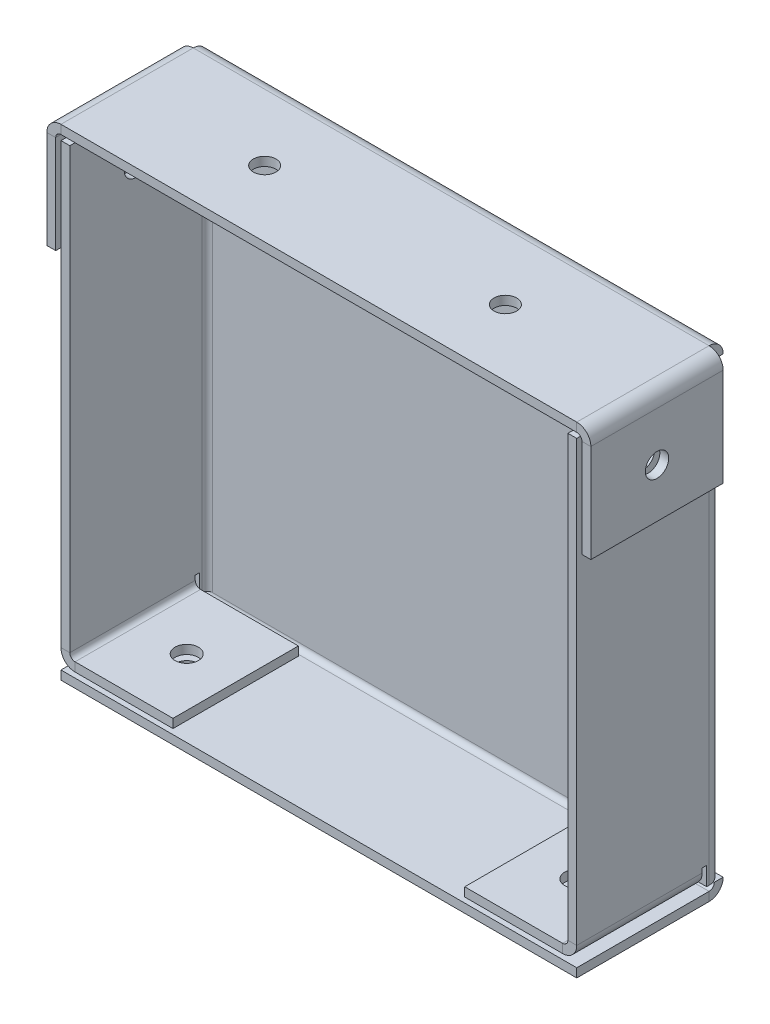
from build123d import *

# Parameters (mm, degrees)
SKETCH1_W                        = 75
SKETCH1_H                        = 70
BASE_FLANGE1_DEPTH               = 1.29
EDGE_FLANGE1_STRIP_W             = 6.684
EDGE_FLANGE1_STRIP_H             = 1.29
EDGE_FLANGE1_STRIP_CUT_DEPTH     = 75
EDGE_FLANGE1_DEPTH               = 75
EDGE_FLANGE2_STRIP_W             = 6.684
EDGE_FLANGE2_STRIP_H             = 1.29
EDGE_FLANGE2_STRIP_CUT_DEPTH     = 75
EDGE_FLANGE2_DEPTH               = 75
EDGE_FLANGE3_STRIP_W             = 6.684
EDGE_FLANGE3_STRIP_H             = 1.29
EDGE_FLANGE3_STRIP_CUT_DEPTH     = 65.896
EDGE_FLANGE3_DEPTH               = 65.896
EDGE_FLANGE4_STRIP_W             = 6.684
EDGE_FLANGE4_STRIP_H             = 1.29
EDGE_FLANGE4_STRIP_CUT_DEPTH     = 65.896
EDGE_FLANGE4_DEPTH               = 65.896
EDGE_FLANGE6_START               = 1.117
EDGE_FLANGE6_DEPTH               = 18.883
EDGE_FLANGE6_2_DEPTH             = 0.645
EDGE_FLANGE6_START_2             = 1.762
EDGE_FLANGE6_3_DEPTH             = 18.238
EDGE_FLANGE8_START               = 1.117
EDGE_FLANGE8_DEPTH               = 18.883
EDGE_FLANGE8_2_DEPTH             = 0.645
EDGE_FLANGE8_START_2             = 1.762
EDGE_FLANGE8_3_DEPTH             = 18.238
EDGE_FLANGE9_DEPTH               = 19.238
EDGE_FLANGE10_DEPTH              = 19.238
TAP_DRILL_FOR_M4X0_7_TAP1_REACH  = 108.005
TAP_DRILL_FOR_M4X0_7_TAP1_BORE_R = 1.65
M3_CLEARANCE_HOLE1_D             = 3.4
M3_CLEARANCE_HOLE1_DEPTH         = 3.342
M3_CLEARANCE_HOLE2_D             = 3.4


# Read off the part's stored shape, not the designer's step: Edge-Flange6, Edge-Flange8
# Sheet-metal steps are written as plain solids
with BuildPart() as part:
    # Sketch1 → Base-Flange1 (new body)
    with BuildSketch(Plane.XY):
        with Locations((37.5, 35)):
            Rectangle(SKETCH1_W, SKETCH1_H)
    extrude(amount=-BASE_FLANGE1_DEPTH)

    # Edge-Flange1 strip (across the edge) → Edge-Flange1 strip cut (cut)
    with BuildSketch(Plane(origin=(75, 70, 0), x_dir=(0, -1, 0), z_dir=(-1, 0, 0))):
        with Locations((-1.29, -0.645)):
            Rectangle(EDGE_FLANGE1_STRIP_W, EDGE_FLANGE1_STRIP_H)
    extrude(amount=EDGE_FLANGE1_STRIP_CUT_DEPTH, mode=Mode.SUBTRACT)

    # Edge-Flange1 section (across the edge) → Edge-Flange1 (add)
    with BuildSketch(Plane(origin=(75, 70, 0), x_dir=(0, -1, 0), z_dir=(-1, 0, 0))):
        with BuildLine():
            Line((0, 0.762), (0, 20))
            Line((0, 20), (1.29, 20))
            Line((1.29, 20), (1.29, 0.762))
            ThreePointArc((1.29, 0.762), (1.513184633, 0.223184633), (2.052, 0))
            Line((2.052, 0), (2.052, -1.29))
            ThreePointArc((2.052, -1.29), (0.601016885, -0.688983115), (0, 0.762))
        make_face()
    extrude(amount=EDGE_FLANGE1_DEPTH)

    # Edge-Flange2 strip (across the edge) → Edge-Flange2 strip cut (cut)
    with BuildSketch(Plane.YZ):
        with Locations((-1.29, -0.645)):
            Rectangle(EDGE_FLANGE2_STRIP_W, EDGE_FLANGE2_STRIP_H)
    extrude(amount=EDGE_FLANGE2_STRIP_CUT_DEPTH, mode=Mode.SUBTRACT)

    # Edge-Flange2 section (across the edge) → Edge-Flange2 (add)
    with BuildSketch(Plane.YZ):
        with BuildLine():
            Line((0, 0.762), (0, 20))
            Line((0, 20), (1.29, 20))
            Line((1.29, 20), (1.29, 0.762))
            ThreePointArc((1.29, 0.762), (1.513184633, 0.223184633), (2.052, 0))
            Line((2.052, 0), (2.052, -1.29))
            ThreePointArc((2.052, -1.29), (0.601016885, -0.688983115), (0, 0.762))
        make_face()
    extrude(amount=EDGE_FLANGE2_DEPTH)

    # Edge-Flange3 strip (across the edge) → Edge-Flange3 strip cut (cut)
    with BuildSketch(Plane.XZ.offset(-67.948)):
        with Locations((-1.29, -0.645)):
            Rectangle(EDGE_FLANGE3_STRIP_W, EDGE_FLANGE3_STRIP_H)
    extrude(amount=EDGE_FLANGE3_STRIP_CUT_DEPTH, mode=Mode.SUBTRACT)

    # Edge-Flange3 section (across the edge) → Edge-Flange3 (add)
    with BuildSketch(Plane.XZ.offset(-67.948)):
        with BuildLine():
            Line((0, 0.762), (0, 20))
            Line((0, 20), (1.29, 20))
            Line((1.29, 20), (1.29, 0.762))
            ThreePointArc((1.29, 0.762), (1.513184633, 0.223184633), (2.052, 0))
            Line((2.052, 0), (2.052, -1.29))
            ThreePointArc((2.052, -1.29), (0.601016885, -0.688983115), (0, 0.762))
        make_face()
    extrude(amount=EDGE_FLANGE3_DEPTH)

    # Edge-Flange4 strip (across the edge) → Edge-Flange4 strip cut (cut)
    with BuildSketch(Plane(origin=(75, 2.052, 0), x_dir=(-1, 0, 0), z_dir=(0, 1, 0))):
        with Locations((-1.29, -0.645)):
            Rectangle(EDGE_FLANGE4_STRIP_W, EDGE_FLANGE4_STRIP_H)
    extrude(amount=EDGE_FLANGE4_STRIP_CUT_DEPTH, mode=Mode.SUBTRACT)

    # Edge-Flange4 section (across the edge) → Edge-Flange4 (add)
    with BuildSketch(Plane(origin=(75, 2.052, 0), x_dir=(-1, 0, 0), z_dir=(0, 1, 0))):
        with BuildLine():
            Line((0, 0.762), (0, 20))
            Line((0, 20), (1.29, 20))
            Line((1.29, 20), (1.29, 0.762))
            ThreePointArc((1.29, 0.762), (1.513184633, 0.223184633), (2.052, 0))
            Line((2.052, 0), (2.052, -1.29))
            ThreePointArc((2.052, -1.29), (0.601016885, -0.688983115), (0, 0.762))
        make_face()
    extrude(amount=EDGE_FLANGE4_DEPTH)

    # Edge-Flange6 outline → Edge-Flange6 (cut)
    with BuildSketch(Plane.XY.offset(EDGE_FLANGE6_START)):
        with BuildLine():
            Line((1.29, 2.052), (1.29, 2.198728366))
            ThreePointArc((1.29, 2.198728366), (0.352834322, 2.953547915), (0, 4.104))
            Line((0, 4.104), (0, 2.052))
            Line((0, 2.052), (1.29, 2.052))
        make_face()
    extrude(amount=EDGE_FLANGE6_DEPTH, mode=Mode.SUBTRACT)

    # Edge-Flange6 2 outline → Edge-Flange6 2 (cut)
    with BuildSketch(Plane.XY.offset(EDGE_FLANGE6_START)):
        with BuildLine():
            ThreePointArc((0, 4.104), (0.352834322, 2.953547915), (1.29, 2.198728366))
            Line((1.29, 2.198728366), (1.29, 4.749))
            Line((1.29, 4.749), (0, 4.749))
            Line((0, 4.749), (0, 4.104))
        make_face()
    extrude(amount=EDGE_FLANGE6_2_DEPTH, mode=Mode.SUBTRACT)

    # Edge-Flange6 3 outline → Edge-Flange6 3 (add)
    with BuildSketch(Plane.XY.offset(EDGE_FLANGE6_START_2)):
        with BuildLine():
            Line((2.052, 2.052), (16.29, 2.052))
            Line((16.29, 2.052), (16.29, 3.342))
            Line((16.29, 3.342), (2.052, 3.342))
            ThreePointArc((2.052, 3.342), (1.513184633, 3.565184633), (1.29, 4.104))
            Line((1.29, 4.104), (1.29, 2.198728366))
            ThreePointArc((1.29, 2.198728366), (1.664000898, 2.089015956), (2.052, 2.052))
        make_face()
    extrude(amount=EDGE_FLANGE6_3_DEPTH)

    # Edge-Flange8 outline → Edge-Flange8 (cut)
    with BuildSketch(Plane.XY.offset(EDGE_FLANGE8_START)):
        with BuildLine():
            ThreePointArc((75, 4.104), (74.647165678, 2.953547915), (73.71, 2.198728366))
            Line((73.71, 2.198728366), (73.71, 2.052))
            Line((73.71, 2.052), (75, 2.052))
            Line((75, 2.052), (75, 4.104))
        make_face()
    extrude(amount=EDGE_FLANGE8_DEPTH, mode=Mode.SUBTRACT)

    # Edge-Flange8 2 outline → Edge-Flange8 2 (cut)
    with BuildSketch(Plane.XY.offset(EDGE_FLANGE8_START)):
        with BuildLine():
            Line((73.71, 4.749), (73.71, 2.198728366))
            ThreePointArc((73.71, 2.198728366), (74.647165678, 2.953547915), (75, 4.104))
            Line((75, 4.104), (75, 4.749))
            Line((75, 4.749), (73.71, 4.749))
        make_face()
    extrude(amount=EDGE_FLANGE8_2_DEPTH, mode=Mode.SUBTRACT)

    # Edge-Flange8 3 outline → Edge-Flange8 3 (add)
    with BuildSketch(Plane.XY.offset(EDGE_FLANGE8_START_2)):
        with BuildLine():
            Line((58.71, 2.052), (72.948, 2.052))
            ThreePointArc((72.948, 2.052), (73.335999102, 2.089015956), (73.71, 2.198728366))
            Line((73.71, 2.198728366), (73.71, 4.104))
            ThreePointArc((73.71, 4.104), (73.486815367, 3.565184633), (72.948, 3.342))
            Line((72.948, 3.342), (58.71, 3.342))
            Line((58.71, 3.342), (58.71, 2.052))
        make_face()
    extrude(amount=EDGE_FLANGE8_3_DEPTH)

    # Edge-Flange9 section (across the edge) → Edge-Flange9 (add)
    with BuildSketch(Plane(origin=(75.762, 68.71, 0.762), x_dir=(-1, 0, 0), z_dir=(0, 0, 1))):
        with BuildLine():
            Line((-1.29, 0.762), (-1.29, 15))
            Line((-1.29, 15), (0, 15))
            Line((0, 15), (0, 0.762))
            ThreePointArc((0, 0.762), (0.223184633, 0.223184633), (0.762, 0))
            Line((0.762, 0), (0.762, -1.29))
            ThreePointArc((0.762, -1.29), (-0.688983115, -0.688983115), (-1.29, 0.762))
        make_face()
    extrude(amount=EDGE_FLANGE9_DEPTH)

    # Edge-Flange10 section (across the edge) → Edge-Flange10 (add)
    with BuildSketch(Plane(origin=(-0.762, 68.71, 20), x_dir=(1, 0, 0), z_dir=(0, 0, -1))):
        with BuildLine():
            Line((-1.29, 0.762), (-1.29, 15))
            Line((-1.29, 15), (0, 15))
            Line((0, 15), (0, 0.762))
            ThreePointArc((0, 0.762), (0.223184633, 0.223184633), (0.762, 0))
            Line((0.762, 0), (0.762, -1.29))
            ThreePointArc((0.762, -1.29), (-0.688983115, -0.688983115), (-1.29, 0.762))
        make_face()
    extrude(amount=EDGE_FLANGE10_DEPTH)

    # Tap Drill for M4x0.7 Tap1 bore → Tap Drill for M4x0.7 Tap1 (cut, up to next)
    with BuildSketch(Plane(origin=(0, 70, 0), x_dir=(1, 0, 0), z_dir=(0, 1, 0)), mode=Mode.PRIVATE) as tap_drill_for_m4x0_7_tap1_sk1:
        with Locations((55, -10.381)):
            Circle(TAP_DRILL_FOR_M4X0_7_TAP1_BORE_R)
    tap_drill_for_m4x0_7_tap1_tool1 = extrude(tap_drill_for_m4x0_7_tap1_sk1.sketch, amount=-TAP_DRILL_FOR_M4X0_7_TAP1_REACH, mode=Mode.PRIVATE) & part.part
    # Tap Drill for M4x0.7 Tap1 bore → Tap Drill for M4x0.7 Tap1 (cut, up to next)
    with BuildSketch(Plane(origin=(0, 70, 0), x_dir=(1, 0, 0), z_dir=(0, 1, 0)), mode=Mode.PRIVATE) as tap_drill_for_m4x0_7_tap1_sk2:
        with Locations((20, -10.381)):
            Circle(TAP_DRILL_FOR_M4X0_7_TAP1_BORE_R)
    tap_drill_for_m4x0_7_tap1_tool2 = extrude(tap_drill_for_m4x0_7_tap1_sk2.sketch, amount=-TAP_DRILL_FOR_M4X0_7_TAP1_REACH, mode=Mode.PRIVATE) & part.part
    add(tap_drill_for_m4x0_7_tap1_tool1.solids().sort_by_distance((55, 70, 10.381))[0], mode=Mode.SUBTRACT)
    add(tap_drill_for_m4x0_7_tap1_tool2.solids().sort_by_distance((20, 70, 10.381))[0], mode=Mode.SUBTRACT)

    # M3 Clearance Hole1
    with Locations(Plane(origin=(0, 3.342, 0), x_dir=(1, 0, 0), z_dir=(0, 1, 0))):
        with Locations((9.171, -10.881), (65.829, -10.881)):
            Hole(M3_CLEARANCE_HOLE1_D / 2, depth=M3_CLEARANCE_HOLE1_DEPTH)

    # M3 Clearance Hole2 (through all)
    with Locations(Plane(origin=(77.052, 0, 0), x_dir=(0, 0, -1), z_dir=(1, 0, 0))):
        with Locations((-10.381, 60.829)):
            Hole(M3_CLEARANCE_HOLE2_D / 2)


solid = part.part
